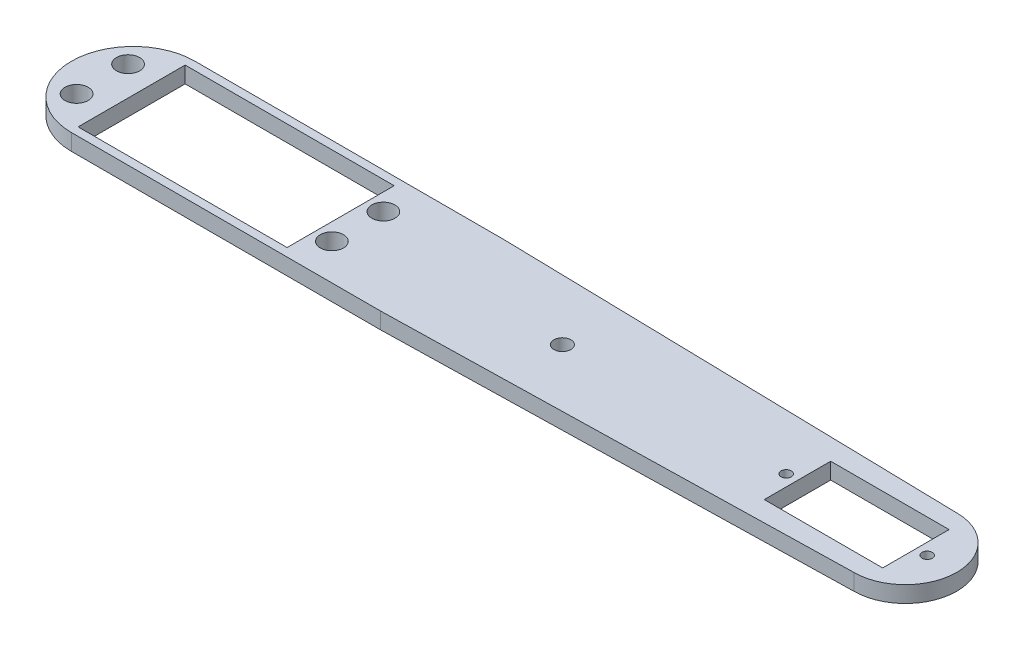
from build123d import *

# Parameters (mm, degrees)
SKETCH1_R           = 2.25
SKETCH1_R_2         = 1
SKETCH1_R_3         = 1.65
SKETCH1_W           = 40.6
SKETCH1_H           = 20.8
SKETCH1_W_2         = 23
SKETCH1_H_2         = 12.9
BOSS_EXTRUDE1_DEPTH = 3.175


with BuildPart() as part:
    # Sketch1 → Boss-Extrude1 (new body)
    with BuildSketch(Plane(origin=(0, 0, 0), x_dir=(1, 0, 0), z_dir=(0, 1, 0))):
        with BuildLine():
            Line((-142.434475161, 14.244652891), (-82.434475161, 14.244652891))
            Line((-82.434475161, 14.244652891), (7.565524839, 12.244652891))
            ThreePointArc((7.565524839, 12.244652891), (17.565524839, 2.244652891), (7.565524839, -7.755347109))
            Line((7.565524839, -7.755347109), (-82.434475161, -9.755347109))
            Line((-82.434475161, -9.755347109), (-142.434475161, -9.755347109))
            ThreePointArc((-142.434475161, -9.755347109), (-154.434475161, 2.244652891), (-142.434475161, 14.244652891))
        make_face()
        with Locations((-148.434475161, 7.244652891)):
            Circle(SKETCH1_R, mode=Mode.SUBTRACT)
        with Locations((-148.434475161, -2.755347109)):
            Circle(SKETCH1_R, mode=Mode.SUBTRACT)
        with Locations((-98.834475161, 7.244652891)):
            Circle(SKETCH1_R, mode=Mode.SUBTRACT)
        with Locations((-98.834475161, -2.755347109)):
            Circle(SKETCH1_R, mode=Mode.SUBTRACT)
        with Locations((-15.58735588, 2.244652891)):
            Circle(SKETCH1_R_2, mode=Mode.SUBTRACT)
        with Locations((11.81264412, 2.244652891)):
            Circle(SKETCH1_R_2, mode=Mode.SUBTRACT)
        with Locations((-59.05531941, 2.244652891)):
            Circle(SKETCH1_R_3, mode=Mode.SUBTRACT)
        with Locations((-122.43974096, 2.244652891)):
            Rectangle(SKETCH1_W, SKETCH1_H, mode=Mode.SUBTRACT)
        with Locations((-1.88735588, 2.244652891)):
            Rectangle(SKETCH1_W_2, SKETCH1_H_2, mode=Mode.SUBTRACT)
    extrude(amount=BOSS_EXTRUDE1_DEPTH)


solid = part.part
